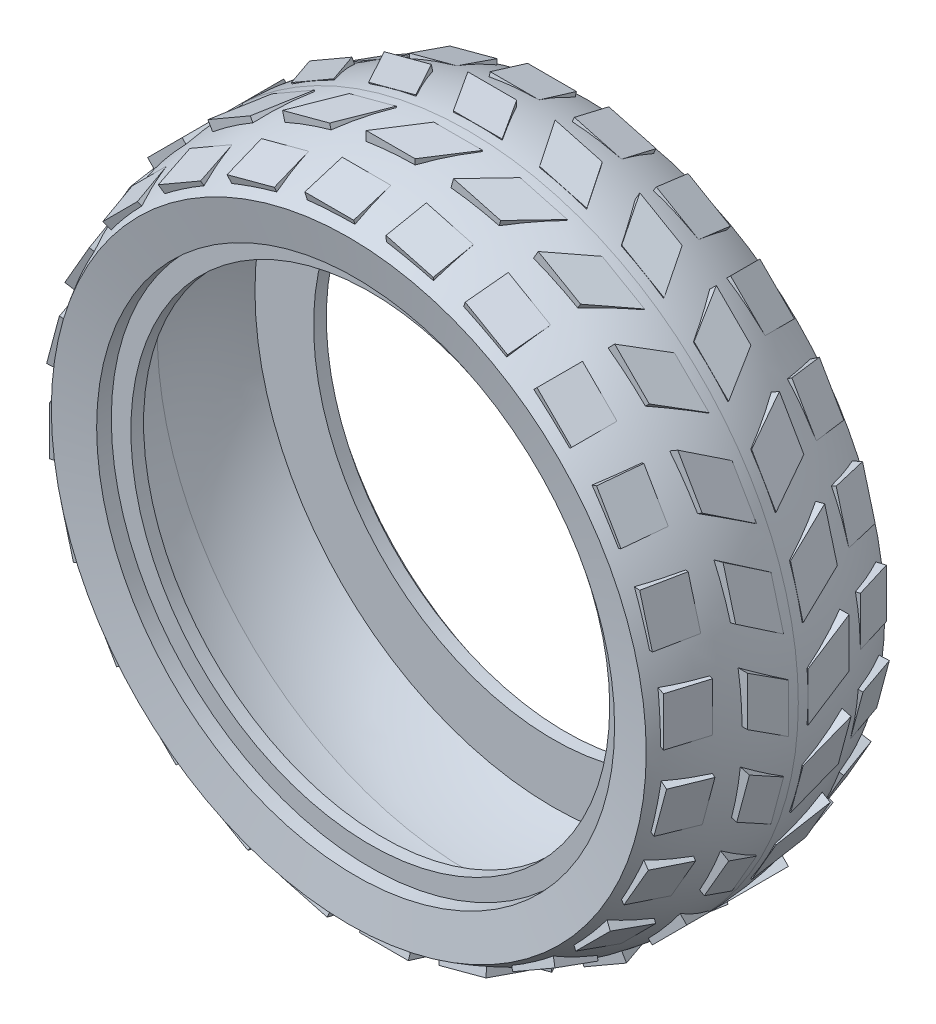
from build123d import *

# Parameters (mm, degrees)
BOSS_EXTRUDE3_REACH            = 78.558
BOSS_EXTRUDE3_END_MAJOR_RADIUS = 10.532418403
BOSS_EXTRUDE3_END_MINOR_RADIUS = 23.268076451
CIRPATTERN1_COUNT              = 24
SKETCH5_W                      = 5
SKETCH5_H                      = 4
BOSS_EXTRUDE5_DEPTH            = 1.05
CIRPATTERN2_COUNT              = 24
CIRPATTERN2_COPY_1_SKETCH_W    = 5
CIRPATTERN2_COPY_1_SKETCH_H    = 4
CIRPATTERN2_COPY_1_DEPTH       = 1.05
CIRPATTERN2_COPY_2_SKETCH_W    = 5
CIRPATTERN2_COPY_2_SKETCH_H    = 4
CIRPATTERN2_COPY_2_DEPTH       = 1.05
CIRPATTERN2_COPY_3_SKETCH_W    = 5
CIRPATTERN2_COPY_3_SKETCH_H    = 4
CIRPATTERN2_COPY_3_DEPTH       = 1.05
CIRPATTERN2_COPY_4_SKETCH_W    = 5
CIRPATTERN2_COPY_4_SKETCH_H    = 4
CIRPATTERN2_COPY_4_DEPTH       = 1.05
CIRPATTERN2_COPY_5_SKETCH_W    = 5
CIRPATTERN2_COPY_5_SKETCH_H    = 4
CIRPATTERN2_COPY_5_DEPTH       = 1.05
CIRPATTERN2_COPY_6_SKETCH_W    = 5
CIRPATTERN2_COPY_6_SKETCH_H    = 4
CIRPATTERN2_COPY_6_DEPTH       = 1.05
CIRPATTERN2_COPY_7_SKETCH_W    = 5
CIRPATTERN2_COPY_7_SKETCH_H    = 4
CIRPATTERN2_COPY_7_DEPTH       = 1.05
CIRPATTERN2_COPY_8_SKETCH_W    = 5
CIRPATTERN2_COPY_8_SKETCH_H    = 4
CIRPATTERN2_COPY_8_DEPTH       = 1.05
CIRPATTERN2_COPY_9_SKETCH_W    = 5
CIRPATTERN2_COPY_9_SKETCH_H    = 4
CIRPATTERN2_COPY_9_DEPTH       = 1.05
CIRPATTERN2_COPY_10_SKETCH_W   = 5
CIRPATTERN2_COPY_10_SKETCH_H   = 4
CIRPATTERN2_COPY_10_DEPTH      = 1.05
CIRPATTERN2_COPY_11_SKETCH_W   = 5
CIRPATTERN2_COPY_11_SKETCH_H   = 4
CIRPATTERN2_COPY_11_DEPTH      = 1.05
CIRPATTERN2_COPY_12_SKETCH_W   = 5
CIRPATTERN2_COPY_12_SKETCH_H   = 4
CIRPATTERN2_COPY_12_DEPTH      = 1.05
CIRPATTERN2_COPY_13_SKETCH_W   = 5
CIRPATTERN2_COPY_13_SKETCH_H   = 4
CIRPATTERN2_COPY_13_DEPTH      = 1.05
CIRPATTERN2_COPY_14_SKETCH_W   = 5
CIRPATTERN2_COPY_14_SKETCH_H   = 4
CIRPATTERN2_COPY_14_DEPTH      = 1.05
CIRPATTERN2_COPY_15_SKETCH_W   = 5
CIRPATTERN2_COPY_15_SKETCH_H   = 4
CIRPATTERN2_COPY_15_DEPTH      = 1.05
CIRPATTERN2_COPY_16_SKETCH_W   = 5
CIRPATTERN2_COPY_16_SKETCH_H   = 4
CIRPATTERN2_COPY_16_DEPTH      = 1.05
CIRPATTERN2_COPY_17_SKETCH_W   = 5
CIRPATTERN2_COPY_17_SKETCH_H   = 4
CIRPATTERN2_COPY_17_DEPTH      = 1.05
CIRPATTERN2_COPY_18_SKETCH_W   = 5
CIRPATTERN2_COPY_18_SKETCH_H   = 4
CIRPATTERN2_COPY_18_DEPTH      = 1.05
CIRPATTERN2_COPY_19_SKETCH_W   = 5
CIRPATTERN2_COPY_19_SKETCH_H   = 4
CIRPATTERN2_COPY_19_DEPTH      = 1.05
CIRPATTERN2_COPY_20_SKETCH_W   = 5
CIRPATTERN2_COPY_20_SKETCH_H   = 4
CIRPATTERN2_COPY_20_DEPTH      = 1.05
CIRPATTERN2_COPY_21_SKETCH_W   = 5
CIRPATTERN2_COPY_21_SKETCH_H   = 4
CIRPATTERN2_COPY_21_DEPTH      = 1.05
CIRPATTERN2_COPY_22_SKETCH_W   = 5
CIRPATTERN2_COPY_22_SKETCH_H   = 4
CIRPATTERN2_COPY_22_DEPTH      = 1.05
CIRPATTERN2_COPY_23_SKETCH_W   = 5
CIRPATTERN2_COPY_23_SKETCH_H   = 4
CIRPATTERN2_COPY_23_DEPTH      = 1.05


with BuildPart() as part:
    # Sketch1 → Revolve1 (revolve)
    with BuildSketch(Plane(origin=(0, 0, 0), x_dir=(0, 0, -1), z_dir=(1, 0, 0)), mode=Mode.PRIVATE) as revolve1_sk:
        with BuildLine():
            Line((-8.7, 24.5), (-10, 24.5))
            Line((-10, 24.5), (-10, 26.5))
            Line((-10, 26.5), (-11.5, 26.5))
            Line((-11.5, 26.5), (-12.2, 30.438273734))
            ThreePointArc((-12.2, 30.438273734), (-6.332929449, 32.964458302), (0, 33.8))
            ThreePointArc((0, 33.8), (6.332929449, 32.964458302), (12.2, 30.438273734))
            Line((12.2, 30.438273734), (11.5, 26.5))
            Line((11.5, 26.5), (10, 26.5))
            Line((10, 26.5), (10, 24.5))
            Line((10, 24.5), (8.7, 24.5))
            Line((8.7, 24.5), (8.7, 30.5))
            ThreePointArc((8.7, 30.5), (4.407873533, 31.53730749), (0, 31.8))
            ThreePointArc((0, 31.8), (-4.407873533, 31.53730749), (-8.7, 30.5))
            Line((-8.7, 30.5), (-8.7, 24.5))
        make_face()
    revolve(revolve1_sk.sketch.rotate(Axis((0, 0, 17.658364551), (0, 0, -1)), 90), axis=Axis((0, 0, 17.658364551), (0, 0, -1)))

    # Boss-Extrude3: up to this torus (the profile starts outside it)
    boss_extrude3_end = Plane(origin=(0, 0, -0.151750945), z_dir=(0, 0, 1)) * Torus(BOSS_EXTRUDE3_END_MAJOR_RADIUS, BOSS_EXTRUDE3_END_MINOR_RADIUS, mode=Mode.PRIVATE)
    # Sketch3 → Boss-Extrude3 (add, up to the surface)
    with BuildSketch(Plane(origin=(33.8, 0, 0), x_dir=(0, 0, -1), z_dir=(1, 0, 0)), mode=Mode.PRIVATE) as boss_extrude3_sk1:
        Polygon((-5.2, 5.212931993), (-5.2, 0.212931993), (-1, -2.5), (-1, 2.5), align=None)
    boss_extrude3_tool1 = extrude(boss_extrude3_sk1.sketch, amount=-BOSS_EXTRUDE3_REACH, mode=Mode.PRIVATE) - boss_extrude3_end
    # Sketch3 → Boss-Extrude3 (add, up to the surface)
    with BuildSketch(Plane(origin=(33.8, 0, 0), x_dir=(0, 0, -1), z_dir=(1, 0, 0)), mode=Mode.PRIVATE) as boss_extrude3_sk2:
        Polygon((1, 2.5), (5.2, 5.212931993), (5.2, 0.212931993), (1, -2.5), align=None)
    boss_extrude3_tool2 = extrude(boss_extrude3_sk2.sketch, amount=-BOSS_EXTRUDE3_REACH, mode=Mode.PRIVATE) - boss_extrude3_end
    boss_extrude3 = boss_extrude3_tool1.solids().sort_by_distance((33.8, 1.356466, 3.1))[0] + boss_extrude3_tool2.solids().sort_by_distance((33.8, 1.356466, -3.1))[0]
    add(boss_extrude3)

    # CirPattern1: Boss-Extrude3 ×24 about axis
    cirpattern1_axis = Axis((0, 0, 0), (0, 0, 1))
    for i in range(1, CIRPATTERN1_COUNT):
        add(boss_extrude3.rotate(cirpattern1_axis, i * 360 / CIRPATTERN1_COUNT))

    # Sketch5 → Boss-Extrude5 (add)
    with BuildSketch(Plane(origin=(30.910734976, 0, 9.450360069), x_dir=(0, -1, 0), z_dir=(0.9563047559630353, 0, 0.2923717047227373))):
        with Locations((-2.8, 0.28216362)):
            Rectangle(SKETCH5_W, SKETCH5_H)
    boss_extrude5 = extrude(amount=BOSS_EXTRUDE5_DEPTH)

    # Mirror1: Boss-Extrude5 across plane
    add(boss_extrude5.mirror(Plane.XY))

    # CirPattern2: Boss-Extrude5 ×24 about axis
    cirpattern2_axis = Axis((0, 0, 0), (0, 0, 1))
    for i in range(1, CIRPATTERN2_COUNT):
        add(boss_extrude5.rotate(cirpattern2_axis, i * 360 / CIRPATTERN2_COUNT))

    # CirPattern2 copy 1 sketch → CirPattern2 copy 1 (add)
    with BuildSketch(Plane(origin=(29.857477223, 8.00028691, -9.450360069), x_dir=(0.25881904510252074, -0.9659258262890683, 0), z_dir=(0.9237194615877607, 0.24750988376535193, -0.2923717047227373))):
        with Locations((-2.8, -0.28216362)):
            Rectangle(CIRPATTERN2_COPY_1_SKETCH_W, CIRPATTERN2_COPY_1_SKETCH_H)
    extrude(amount=CIRPATTERN2_COPY_1_DEPTH)

    # CirPattern2 copy 2 sketch → CirPattern2 copy 2 (add)
    with BuildSketch(Plane(origin=(26.769481739, 15.455367488, -9.450360069), x_dir=(0.49999999999999994, -0.8660254037844387, 0), z_dir=(0.8281842124238668, 0.4781523779815176, -0.2923717047227373))):
        with Locations((-2.8, -0.28216362)):
            Rectangle(CIRPATTERN2_COPY_2_SKETCH_W, CIRPATTERN2_COPY_2_SKETCH_H)
    extrude(amount=CIRPATTERN2_COPY_2_DEPTH)

    # CirPattern2 copy 3 sketch → CirPattern2 copy 3 (add)
    with BuildSketch(Plane(origin=(21.857190313, 21.857190313, -9.450360069), x_dir=(0.7071067811865475, -0.7071067811865476, 0), z_dir=(0.6762095778224088, 0.6762095778224086, -0.2923717047227373))):
        with Locations((-2.8, -0.28216362)):
            Rectangle(CIRPATTERN2_COPY_3_SKETCH_W, CIRPATTERN2_COPY_3_SKETCH_H)
    extrude(amount=CIRPATTERN2_COPY_3_DEPTH)

    # CirPattern2 copy 4 sketch → CirPattern2 copy 4 (add)
    with BuildSketch(Plane(origin=(15.455367488, 26.769481739, -9.450360069), x_dir=(0.8660254037844386, -0.5000000000000001, 0), z_dir=(0.4781523779815178, 0.8281842124238666, -0.2923717047227373))):
        with Locations((-2.8, -0.28216362)):
            Rectangle(CIRPATTERN2_COPY_4_SKETCH_W, CIRPATTERN2_COPY_4_SKETCH_H)
    extrude(amount=CIRPATTERN2_COPY_4_DEPTH)

    # CirPattern2 copy 5 sketch → CirPattern2 copy 5 (add)
    with BuildSketch(Plane(origin=(8.00028691, 29.857477223, -9.450360069), x_dir=(0.9659258262890683, -0.25881904510252074, 0), z_dir=(0.24750988376535193, 0.9237194615877607, -0.2923717047227373))):
        with Locations((-2.8, -0.28216362)):
            Rectangle(CIRPATTERN2_COPY_5_SKETCH_W, CIRPATTERN2_COPY_5_SKETCH_H)
    extrude(amount=CIRPATTERN2_COPY_5_DEPTH)

    # CirPattern2 copy 6 sketch → CirPattern2 copy 6 (add)
    with BuildSketch(Plane(origin=(0, 30.910734976, -9.450360069), x_dir=(1, 0, 0), z_dir=(0, 0.9563047559630353, -0.2923717047227373))):
        with Locations((-2.8, -0.28216362)):
            Rectangle(CIRPATTERN2_COPY_6_SKETCH_W, CIRPATTERN2_COPY_6_SKETCH_H)
    extrude(amount=CIRPATTERN2_COPY_6_DEPTH)

    # CirPattern2 copy 7 sketch → CirPattern2 copy 7 (add)
    with BuildSketch(Plane(origin=(-8.00028691, 29.857477223, -9.450360069), x_dir=(0.9659258262890683, 0.25881904510252085, 0), z_dir=(-0.24750988376535205, 0.9237194615877607, -0.29237170472273727))):
        with Locations((-2.8, -0.28216362)):
            Rectangle(CIRPATTERN2_COPY_7_SKETCH_W, CIRPATTERN2_COPY_7_SKETCH_H)
    extrude(amount=CIRPATTERN2_COPY_7_DEPTH)

    # CirPattern2 copy 8 sketch → CirPattern2 copy 8 (add)
    with BuildSketch(Plane(origin=(-15.455367488, 26.769481739, -9.450360069), x_dir=(0.8660254037844387, 0.4999999999999998, 0), z_dir=(-0.47815237798151744, 0.8281842124238668, -0.2923717047227373))):
        with Locations((-2.8, -0.28216362)):
            Rectangle(CIRPATTERN2_COPY_8_SKETCH_W, CIRPATTERN2_COPY_8_SKETCH_H)
    extrude(amount=CIRPATTERN2_COPY_8_DEPTH)

    # CirPattern2 copy 9 sketch → CirPattern2 copy 9 (add)
    with BuildSketch(Plane(origin=(-21.857190313, 21.857190313, -9.450360069), x_dir=(0.7071067811865476, 0.7071067811865475, 0), z_dir=(-0.6762095778224086, 0.6762095778224088, -0.2923717047227373))):
        with Locations((-2.8, -0.28216362)):
            Rectangle(CIRPATTERN2_COPY_9_SKETCH_W, CIRPATTERN2_COPY_9_SKETCH_H)
    extrude(amount=CIRPATTERN2_COPY_9_DEPTH)

    # CirPattern2 copy 10 sketch → CirPattern2 copy 10 (add)
    with BuildSketch(Plane(origin=(-26.769481739, 15.455367488, -9.450360069), x_dir=(0.49999999999999994, 0.8660254037844387, 0), z_dir=(-0.8281842124238668, 0.4781523779815176, -0.2923717047227373))):
        with Locations((-2.8, -0.28216362)):
            Rectangle(CIRPATTERN2_COPY_10_SKETCH_W, CIRPATTERN2_COPY_10_SKETCH_H)
    extrude(amount=CIRPATTERN2_COPY_10_DEPTH)

    # CirPattern2 copy 11 sketch → CirPattern2 copy 11 (add)
    with BuildSketch(Plane(origin=(-29.857477223, 8.00028691, -9.450360069), x_dir=(0.258819045102521, 0.9659258262890682, 0), z_dir=(-0.9237194615877606, 0.24750988376535218, -0.2923717047227373))):
        with Locations((-2.8, -0.28216362)):
            Rectangle(CIRPATTERN2_COPY_11_SKETCH_W, CIRPATTERN2_COPY_11_SKETCH_H)
    extrude(amount=CIRPATTERN2_COPY_11_DEPTH)

    # CirPattern2 copy 12 sketch → CirPattern2 copy 12 (add)
    with BuildSketch(Plane(origin=(-30.910734976, 0, -9.450360069), x_dir=(0, 1, 0), z_dir=(-0.9563047559630353, 0, -0.2923717047227373))):
        with Locations((-2.8, -0.28216362)):
            Rectangle(CIRPATTERN2_COPY_12_SKETCH_W, CIRPATTERN2_COPY_12_SKETCH_H)
    extrude(amount=CIRPATTERN2_COPY_12_DEPTH)

    # CirPattern2 copy 13 sketch → CirPattern2 copy 13 (add)
    with BuildSketch(Plane(origin=(-29.857477223, -8.00028691, -9.450360069), x_dir=(-0.2588190451025208, 0.9659258262890683, 0), z_dir=(-0.9237194615877607, -0.247509883765352, -0.29237170472273727))):
        with Locations((-2.8, -0.28216362)):
            Rectangle(CIRPATTERN2_COPY_13_SKETCH_W, CIRPATTERN2_COPY_13_SKETCH_H)
    extrude(amount=CIRPATTERN2_COPY_13_DEPTH)

    # CirPattern2 copy 14 sketch → CirPattern2 copy 14 (add)
    with BuildSketch(Plane(origin=(-26.769481739, -15.455367488, -9.450360069), x_dir=(-0.5000000000000001, 0.8660254037844386, 0), z_dir=(-0.8281842124238666, -0.4781523779815178, -0.2923717047227373))):
        with Locations((-2.8, -0.28216362)):
            Rectangle(CIRPATTERN2_COPY_14_SKETCH_W, CIRPATTERN2_COPY_14_SKETCH_H)
    extrude(amount=CIRPATTERN2_COPY_14_DEPTH)

    # CirPattern2 copy 15 sketch → CirPattern2 copy 15 (add)
    with BuildSketch(Plane(origin=(-21.857190313, -21.857190313, -9.450360069), x_dir=(-0.7071067811865475, 0.7071067811865477, 0), z_dir=(-0.6762095778224089, -0.6762095778224086, -0.2923717047227373))):
        with Locations((-2.8, -0.28216362)):
            Rectangle(CIRPATTERN2_COPY_15_SKETCH_W, CIRPATTERN2_COPY_15_SKETCH_H)
    extrude(amount=CIRPATTERN2_COPY_15_DEPTH)

    # CirPattern2 copy 16 sketch → CirPattern2 copy 16 (add)
    with BuildSketch(Plane(origin=(-15.455367488, -26.769481739, -9.450360069), x_dir=(-0.8660254037844384, 0.5000000000000004, 0), z_dir=(-0.4781523779815181, -0.8281842124238664, -0.2923717047227373))):
        with Locations((-2.8, -0.28216362)):
            Rectangle(CIRPATTERN2_COPY_16_SKETCH_W, CIRPATTERN2_COPY_16_SKETCH_H)
    extrude(amount=CIRPATTERN2_COPY_16_DEPTH)

    # CirPattern2 copy 17 sketch → CirPattern2 copy 17 (add)
    with BuildSketch(Plane(origin=(-8.00028691, -29.857477223, -9.450360069), x_dir=(-0.9659258262890683, 0.25881904510252063, 0), z_dir=(-0.24750988376535182, -0.9237194615877607, -0.2923717047227373))):
        with Locations((-2.8, -0.28216362)):
            Rectangle(CIRPATTERN2_COPY_17_SKETCH_W, CIRPATTERN2_COPY_17_SKETCH_H)
    extrude(amount=CIRPATTERN2_COPY_17_DEPTH)

    # CirPattern2 copy 18 sketch → CirPattern2 copy 18 (add)
    with BuildSketch(Plane(origin=(0, -30.910734976, -9.450360069), x_dir=(-1, 0, 0), z_dir=(0, -0.9563047559630353, -0.2923717047227373))):
        with Locations((-2.8, -0.28216362)):
            Rectangle(CIRPATTERN2_COPY_18_SKETCH_W, CIRPATTERN2_COPY_18_SKETCH_H)
    extrude(amount=CIRPATTERN2_COPY_18_DEPTH)

    # CirPattern2 copy 19 sketch → CirPattern2 copy 19 (add)
    with BuildSketch(Plane(origin=(8.00028691, -29.857477223, -9.450360069), x_dir=(-0.9659258262890684, -0.2588190451025203, 0), z_dir=(0.2475098837653515, -0.9237194615877609, -0.2923717047227373))):
        with Locations((-2.8, -0.28216362)):
            Rectangle(CIRPATTERN2_COPY_19_SKETCH_W, CIRPATTERN2_COPY_19_SKETCH_H)
    extrude(amount=CIRPATTERN2_COPY_19_DEPTH)

    # CirPattern2 copy 20 sketch → CirPattern2 copy 20 (add)
    with BuildSketch(Plane(origin=(15.455367488, -26.769481739, -9.450360069), x_dir=(-0.8660254037844386, -0.5000000000000001, 0), z_dir=(0.4781523779815178, -0.8281842124238666, -0.2923717047227373))):
        with Locations((-2.8, -0.28216362)):
            Rectangle(CIRPATTERN2_COPY_20_SKETCH_W, CIRPATTERN2_COPY_20_SKETCH_H)
    extrude(amount=CIRPATTERN2_COPY_20_DEPTH)

    # CirPattern2 copy 21 sketch → CirPattern2 copy 21 (add)
    with BuildSketch(Plane(origin=(21.857190313, -21.857190313, -9.450360069), x_dir=(-0.7071067811865477, -0.7071067811865474, 0), z_dir=(0.6762095778224085, -0.6762095778224089, -0.2923717047227373))):
        with Locations((-2.8, -0.28216362)):
            Rectangle(CIRPATTERN2_COPY_21_SKETCH_W, CIRPATTERN2_COPY_21_SKETCH_H)
    extrude(amount=CIRPATTERN2_COPY_21_DEPTH)

    # CirPattern2 copy 22 sketch → CirPattern2 copy 22 (add)
    with BuildSketch(Plane(origin=(26.769481739, -15.455367488, -9.450360069), x_dir=(-0.5000000000000004, -0.8660254037844384, 0), z_dir=(0.8281842124238664, -0.4781523779815181, -0.2923717047227373))):
        with Locations((-2.8, -0.28216362)):
            Rectangle(CIRPATTERN2_COPY_22_SKETCH_W, CIRPATTERN2_COPY_22_SKETCH_H)
    extrude(amount=CIRPATTERN2_COPY_22_DEPTH)

    # CirPattern2 copy 23 sketch → CirPattern2 copy 23 (add)
    with BuildSketch(Plane(origin=(29.857477223, -8.00028691, -9.450360069), x_dir=(-0.2588190451025207, -0.9659258262890683, 0), z_dir=(0.9237194615877607, -0.24750988376535188, -0.2923717047227373))):
        with Locations((-2.8, -0.28216362)):
            Rectangle(CIRPATTERN2_COPY_23_SKETCH_W, CIRPATTERN2_COPY_23_SKETCH_H)
    extrude(amount=CIRPATTERN2_COPY_23_DEPTH)


solid = part.part
